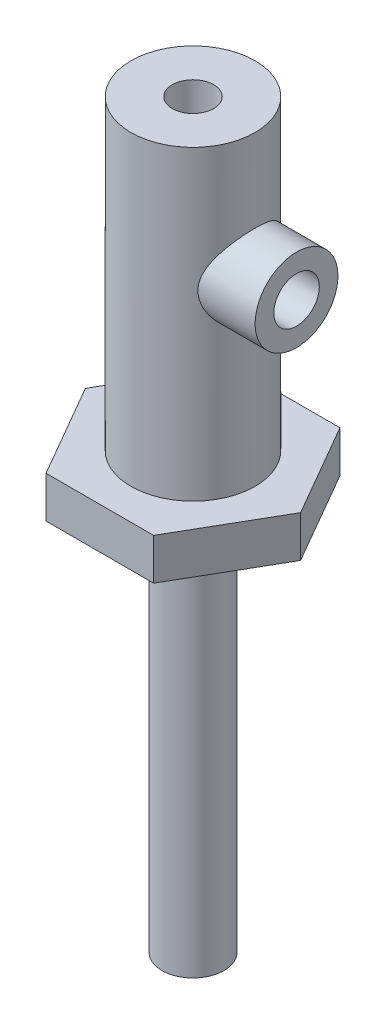
from build123d import *

# Parameters (mm, degrees)
SKETCH1_R                = 3
BOSS_EXTRUDE1_DEPTH      = 16.8
SKETCH2_R                = 1
CUT_EXTRUDE3_DEPTH       = 10.2
BOSS_EXTRUDE2_DEPTH      = 2
SKETCH4_R                = 1.5
BOSS_EXTRUDE3_DEPTH      = 19
BOSS_EXTRUDE4_DEPTH      = 2
BOSS_EXTRUDE4_DEPTH_BACK = 1
SKETCH6_R                = 2
SKETCH6_R_2              = 1.1
SKETCH7_R                = 1.1
CUT_EXTRUDE4_DEPTH       = 3


with BuildPart() as part:
    # Sketch1 → Boss-Extrude1 (new body)
    with BuildSketch(Plane(origin=(0, 0, 0), x_dir=(1, 0, 0), z_dir=(0, 1, 0))):
        Circle(SKETCH1_R)
    extrude(amount=BOSS_EXTRUDE1_DEPTH)

    # Sketch2 → Cut-Extrude3 (cut)
    with BuildSketch(Plane(origin=(0, 16.8, 0), x_dir=(1, 0, 0), z_dir=(0, 1, 0))):
        Circle(SKETCH2_R)
    extrude(amount=-CUT_EXTRUDE3_DEPTH, mode=Mode.SUBTRACT)

    # Sketch3 → Boss-Extrude2 (add)
    with BuildSketch(Plane(origin=(0, 0, 0), x_dir=(-1, 0, 0), z_dir=(0, -1, 0))):
        Polygon((5.196152423, 0), (2.598076211, 4.5), (-2.598076211, 4.5), (-5.196152423, 0), (-2.598076211, -4.5), (2.598076211, -4.5), align=None)
    extrude(amount=-BOSS_EXTRUDE2_DEPTH)

    # Sketch4 → Boss-Extrude3 (add)
    with BuildSketch(Plane(origin=(0, 0, 0), x_dir=(-1, 0, 0), z_dir=(0, -1, 0))):
        Circle(SKETCH4_R)
    extrude(amount=BOSS_EXTRUDE3_DEPTH)

    # Sketch6 → Boss-Extrude4 (add, two sides: drawn at the far end of the back side and taken through both)
    with BuildSketch(Plane(origin=(3, 0, 0), x_dir=(0, 0, -1), z_dir=(1, 0, 0)).offset(-BOSS_EXTRUDE4_DEPTH_BACK)):
        with Locations((0, 10.8)):
            Circle(SKETCH6_R)
        with Locations((0, 10.8)):
            Circle(SKETCH6_R_2, mode=Mode.SUBTRACT)
    extrude(amount=BOSS_EXTRUDE4_DEPTH + BOSS_EXTRUDE4_DEPTH_BACK)

    # Sketch7 → Cut-Extrude4 (cut)
    with BuildSketch(Plane(origin=(3, 0, 0), x_dir=(0, 0, -1), z_dir=(1, 0, 0))):
        with Locations((0, 10.8)):
            Circle(SKETCH7_R)
    extrude(amount=-CUT_EXTRUDE4_DEPTH, mode=Mode.SUBTRACT)


solid = part.part
